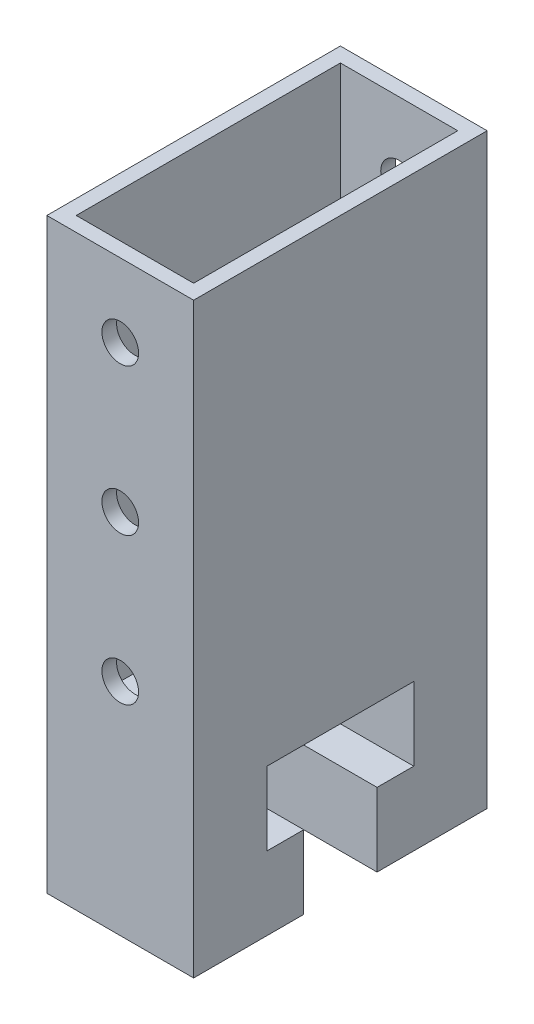
from build123d import *

# Parameters (mm, degrees)
SKETCH1_W           = 25.4
SKETCH1_H           = 101.6
BOSS_EXTRUDE1_DEPTH = 25.4
SKETCH2_R           = 3.175
CUT_EXTRUDE1_DEPTH  = 117.397422652
SKETCH3_W           = 20.32
SKETCH3_H           = 45.72
CUT_EXTRUDE2_DEPTH  = 73.66
CUT_EXTRUDE3_DEPTH  = 108.763073453


with BuildPart() as part:
    # Sketch1 → Boss-Extrude1 (new, symmetric)
    with BuildSketch(Plane.XY):
        with Locations((12.7, 50.8)):
            Rectangle(SKETCH1_W, SKETCH1_H)
    extrude(amount=BOSS_EXTRUDE1_DEPTH, both=True)

    # Sketch2 → Cut-Extrude1 (cut, through all)
    with BuildSketch(Plane.XY.offset(25.4)):
        with Locations((12.7, 38.1)):
            Circle(SKETCH2_R)
        with Locations((12.7, 63.5)):
            Circle(SKETCH2_R)
        with Locations((12.7, 88.9)):
            Circle(SKETCH2_R)
    extrude(amount=-CUT_EXTRUDE1_DEPTH, mode=Mode.SUBTRACT)

    # Sketch3 → Cut-Extrude2 (cut)
    with BuildSketch(Plane(origin=(0, 101.6, 0), x_dir=(1, 0, 0), z_dir=(0, 1, 0))):
        with Locations((12.7, 0)):
            Rectangle(SKETCH3_W, SKETCH3_H)
    extrude(amount=-CUT_EXTRUDE2_DEPTH, mode=Mode.SUBTRACT)

    # Sketch4 → Cut-Extrude3 (cut, through all)
    with BuildSketch(Plane(origin=(25.4, 0, 0), x_dir=(0, 0, -1), z_dir=(1, 0, 0))):
        Polygon((-6.35, 0), (-6.35, 12.7), (-12.7, 12.7), (-12.7, 25.4), (12.7, 25.4), (12.7, 12.7), (6.35, 12.7), (6.35, 0), align=None)
    extrude(amount=-CUT_EXTRUDE3_DEPTH, mode=Mode.SUBTRACT)


solid = part.part
